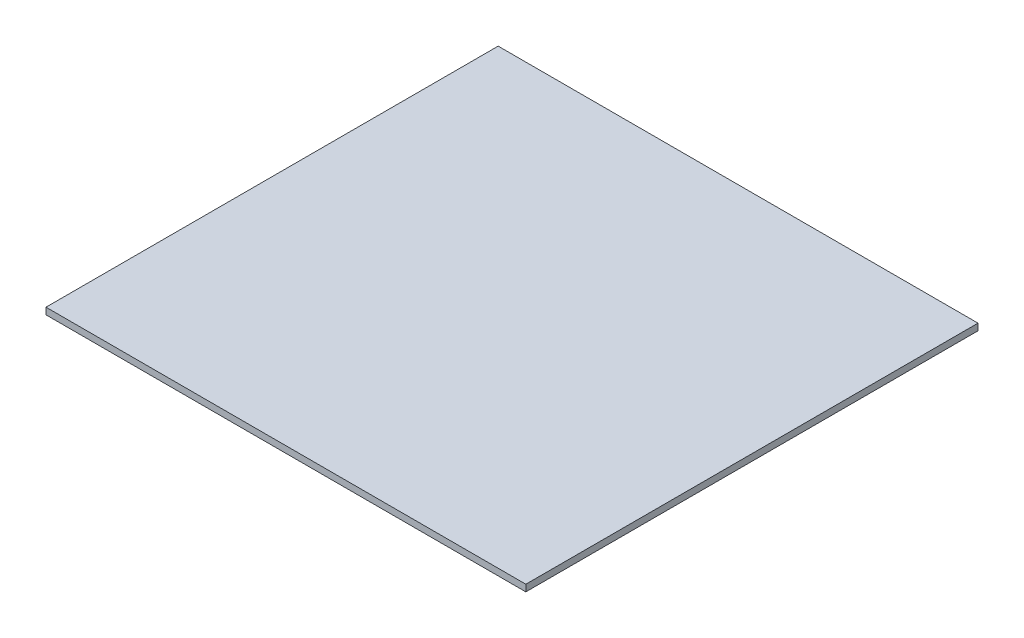
from build123d import *

# Parameters (mm, degrees)
SKETCH1_W           = 229.108
SKETCH1_H           = 215.9
BOSS_EXTRUDE1_DEPTH = 3.175


with BuildPart() as part:
    # Sketch1 → Boss-Extrude1 (new body)
    with BuildSketch(Plane(origin=(0, 0, 0), x_dir=(1, 0, 0), z_dir=(0, 1, 0))):
        with Locations((114.554, 107.95)):
            Rectangle(SKETCH1_W, SKETCH1_H)
    extrude(amount=BOSS_EXTRUDE1_DEPTH)


solid = part.part
